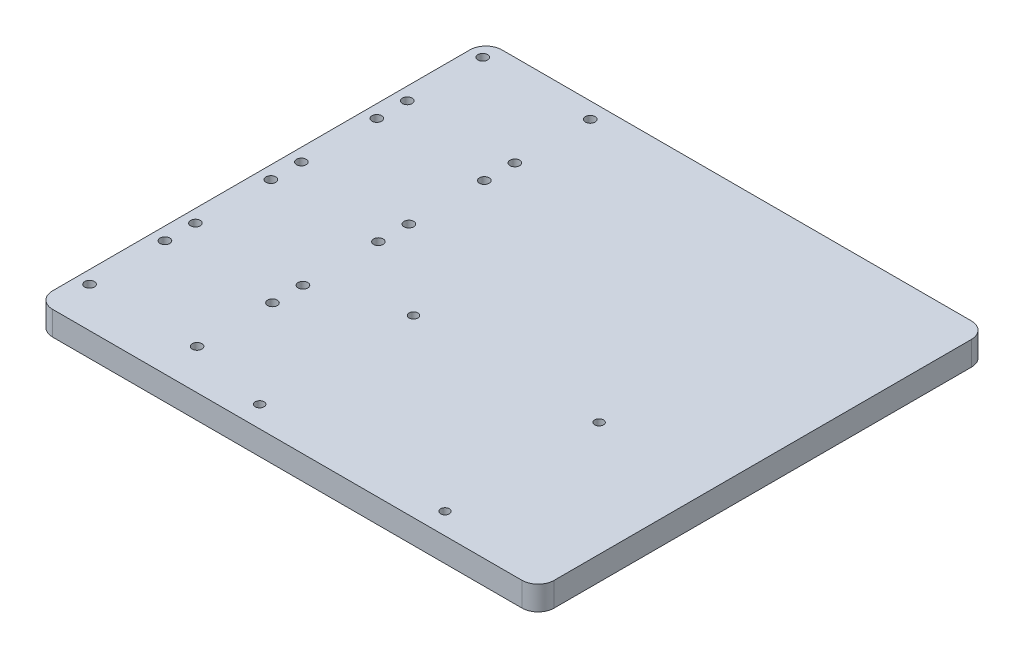
from build123d import *

# Parameters (mm, degrees)
BOSS_EXTRUDE1_DEPTH = 7.62
SKETCH3_R           = 1.397
SKETCH3_R_2         = 1.524
CUT_EXTRUDE1_DEPTH  = 7.62
FILLET1_R           = 5.08


with BuildPart() as part:
    # Sketch1 → Boss-Extrude1 (new body)
    with BuildSketch(Plane(origin=(0, 0, 0), x_dir=(1, 0, 0), z_dir=(0, 1, 0))):
        Polygon((0, 0), (120.65, 0), (120.65, 142.24), (-38.1, 142.24), (-38.1, 0), align=None)
    extrude(amount=BOSS_EXTRUDE1_DEPTH)

    # Sketch3 → Cut-Extrude1 (cut)
    with BuildSketch(Plane(origin=(0, 7.62, 0), x_dir=(1, 0, 0), z_dir=(0, 1, 0))):
        with Locations((25.781, 6.731)):
            Circle(SKETCH3_R)
        with Locations((25.781, 55.4355)):
            Circle(SKETCH3_R)
        with Locations((84.455, 55.499)):
            Circle(SKETCH3_R)
        with Locations((84.455, 6.731)):
            Circle(SKETCH3_R)
        with Locations((-34.036, 137.16)):
            Circle(SKETCH3_R_2)
        with Locations((0, 137.16)):
            Circle(SKETCH3_R_2)
        with Locations((-34.036, 113.284)):
            Circle(SKETCH3_R_2)
        with Locations((0, 113.284)):
            Circle(SKETCH3_R_2)
        with Locations((-34.036, 103.632)):
            Circle(SKETCH3_R_2)
        with Locations((0, 103.632)):
            Circle(SKETCH3_R_2)
        with Locations((-34.036, 79.756)):
            Circle(SKETCH3_R_2)
        with Locations((0, 79.756)):
            Circle(SKETCH3_R_2)
        with Locations((-34.036, 70.104)):
            Circle(SKETCH3_R_2)
        with Locations((0, 70.104)):
            Circle(SKETCH3_R_2)
        with Locations((-34.036, 46.228)):
            Circle(SKETCH3_R_2)
        with Locations((0, 46.228)):
            Circle(SKETCH3_R_2)
        with Locations((-34.036, 36.576)):
            Circle(SKETCH3_R_2)
        with Locations((0, 36.576)):
            Circle(SKETCH3_R_2)
        with Locations((-34.036, 12.7)):
            Circle(SKETCH3_R_2)
        with Locations((0, 12.7)):
            Circle(SKETCH3_R_2)
    extrude(amount=-CUT_EXTRUDE1_DEPTH, mode=Mode.SUBTRACT)

    # Fillet1
    fillet1_edges = [part.edges().sort_by_distance(p)[0] for p in [
        (-38.1, 3.81, 0),
        (120.65, 3.81, 0),
        (120.65, 3.81, -142.24),
        (-38.1, 3.81, -142.24),
    ]]
    fillet(fillet1_edges, radius=FILLET1_R)


solid = part.part
